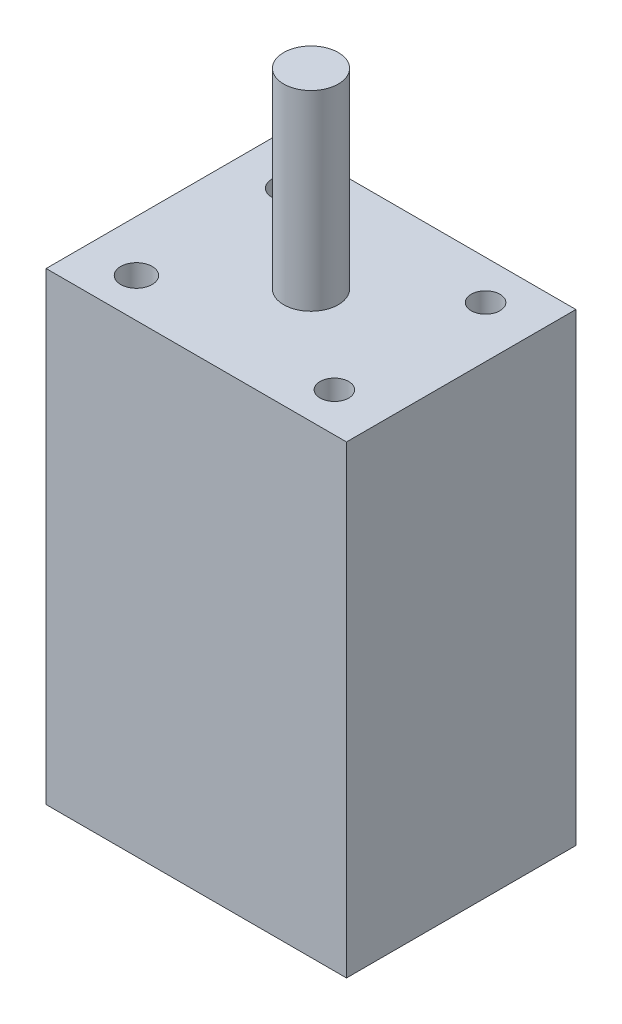
from build123d import *

# Parameters (mm, degrees)
F_01_HOUSING_PROFILE_W      = 55
F_01_HOUSING_PROFILE_H      = 42
F_01_HOUSING_PROFILE_R      = 2.877277304
F_01_HOUSING_PROFILE_R_2    = 2.627218626
F_01_HOUSING_BLOCK_DEPTH    = 85
F_03_OUTPUT_SHAFT_PROFILE_R = 5
F_03_OUTPUT_SHAFT_DEPTH     = 120


with BuildPart() as part:
    # 01_Housing_Profile → 01_Housing_Block (new body)
    with BuildSketch(Plane(origin=(0, 0, 0), x_dir=(1, 0, 0), z_dir=(0, 1, 0))):
        Rectangle(F_01_HOUSING_PROFILE_W, F_01_HOUSING_PROFILE_H)
        with Locations((-18.122781374, -13.839214867)):
            Circle(F_01_HOUSING_PROFILE_R, mode=Mode.SUBTRACT)
        with Locations((18.122781374, -13.839214867)):
            Circle(F_01_HOUSING_PROFILE_R_2, mode=Mode.SUBTRACT)
        with Locations((-18.122781374, 13.839214867)):
            Circle(F_01_HOUSING_PROFILE_R, mode=Mode.SUBTRACT)
        with Locations((18.122781374, 13.839214867)):
            Circle(F_01_HOUSING_PROFILE_R_2, mode=Mode.SUBTRACT)
    extrude(amount=F_01_HOUSING_BLOCK_DEPTH)

    # 03_Output_Shaft_Profile → 03_Output_Shaft (add)
    with BuildSketch(Plane(origin=(0, 0, 0), x_dir=(1, 0, 0), z_dir=(0, 1, 0))):
        Circle(F_03_OUTPUT_SHAFT_PROFILE_R)
    extrude(amount=F_03_OUTPUT_SHAFT_DEPTH)


solid = part.part
